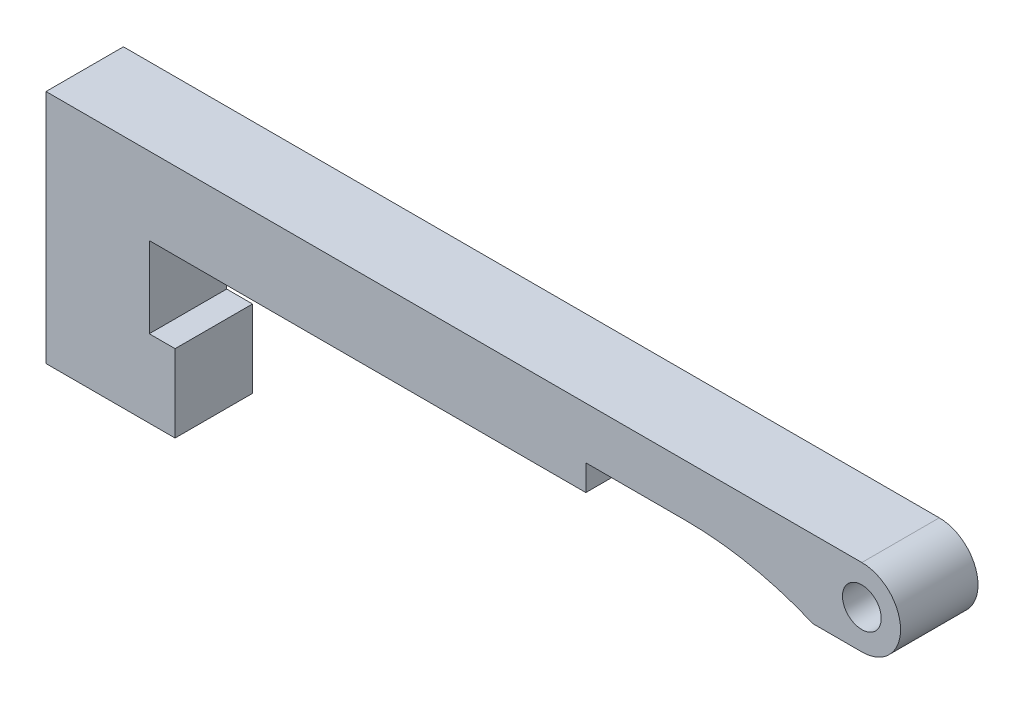
from build123d import *

# Parameters (mm, degrees)
SKETCH1_R           = 7.5
BOSS_EXTRUDE1_DEPTH = 30


with BuildPart() as part:
    # Sketch1 → Boss-Extrude1 (new body)
    with BuildSketch(Plane.XY):
        with BuildLine():
            Line((50, 0), (0, 0))
            Line((0, 0), (0, 91.277754561))
            Line((0, 91.277754561), (316.053358226, 91.277754561))
            ThreePointArc((316.053358226, 91.277754561), (331.053358226, 76.277754561), (316.053358226, 61.277754561))
            Line((316.053358226, 61.277754561), (297.117294617, 61.277754561))
            ThreePointArc((297.117294617, 61.277754561), (272.944697244, 68.752603598), (247.769085146, 71.277754561))
            Line((247.769085146, 71.277754561), (209.131973217, 71.277754561))
            Line((209.131973217, 71.277754561), (209.131973217, 61.277754561))
            Line((209.131973217, 61.277754561), (40, 61.277754561))
            Line((40, 61.277754561), (40, 30))
            Line((40, 30), (50, 30))
            Line((50, 30), (50, 0))
        make_face()
        with Locations((316.053358226, 76.277754561)):
            Circle(SKETCH1_R, mode=Mode.SUBTRACT)
    extrude(amount=BOSS_EXTRUDE1_DEPTH)


solid = part.part
